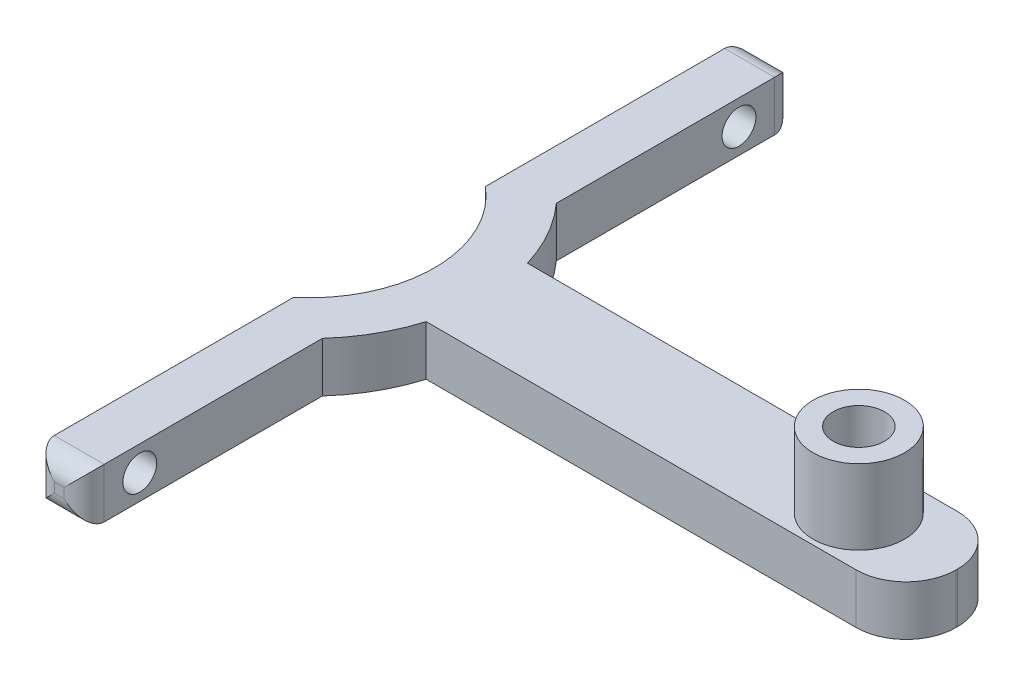
from build123d import *
from build123d.topology import SkipClean

# Parameters (mm, degrees)
SKETCH1_R                = 22.225
SKETCH1_R_2              = 15.875
BOSS_EXTRUDE1_DEPTH      = 3.175
BOSS_EXTRUDE2_DEPTH      = 3.175
F_0_257_DIAMETER_HOLE1_D = 6.5278
SKETCH6_W                = 65.552410467
SKETCH6_H                = 82.171101747
CUT_EXTRUDE2_DEPTH       = 86.310457973
BOSS_EXTRUDE3_DEPTH      = 3.175
SKETCH12_R               = 2.15265
CUT_EXTRUDE4_DEPTH       = 80.867912855
SKETCH13_R               = 5.8039
SKETCH13_R_2             = 3.2639
BOSS_EXTRUDE4_DEPTH      = 9.525
MIRROR2_START            = -3.175
MIRROR2_OUTLINE_R        = 3.2639
MIRROR2_DEPTH            = 1.0223499
MIRROR2_START_2          = 12.081931798
MIRROR2_2_OUTLINE_W      = 2.1526501
MIRROR2_2_OUTLINE_H      = 12.8778
MIRROR2_2_DEPTH          = 70.221427729
MIRROR2_START_3          = 10.16
MIRROR2_3_DEPTH          = 11.111840348
MIRROR2_4_DEPTH          = 6.35
MIRROR2_START_4          = -2.1526501
MIRROR2_5_OUTLINE_R      = 3.2639
MIRROR2_5_DEPTH          = 2.1526501
FILLET5_R                = 2.54


with BuildPart() as part:
    # Sketch1 → Boss-Extrude1 (new body)
    with BuildSketch(Plane(origin=(0, 0, 0), x_dir=(1, 0, 0), z_dir=(0, 1, 0))):
        with Locations(Location((0, 0, 0), (0, 0, 270))):
            Circle(SKETCH1_R)
        with Locations(Location((0, 0, 0), (0, 0, 270))):
            Circle(SKETCH1_R_2, mode=Mode.SUBTRACT)
    extrude(amount=BOSS_EXTRUDE1_DEPTH)

    # Sketch2 → Boss-Extrude2 (add)
    with BuildSketch(Plane(origin=(0, 3.175, 0), x_dir=(1, 0, 0), z_dir=(0, 1, 0))):
        with BuildLine():
            Line((75.953359527, -6.4389), (38.518839527, -6.4389))
            Line((38.518839527, -6.4389), (17.590769706, -6.4389))
            Line((17.590769706, -6.4389), (17.590769706, 6.4389))
            Line((17.590769706, 6.4389), (38.518839527, 6.4389))
            Line((38.518839527, 6.4389), (75.953359527, 6.4389))
            ThreePointArc((75.953359527, 6.4389), (80.443487588, 4.579028061), (82.303359527, 0.0889))
            Line((82.303359527, 0.0889), (82.303359527, -0.0889))
            ThreePointArc((82.303359527, -0.0889), (80.443487588, -4.579028061), (75.953359527, -6.4389))
        make_face()
    extrude(amount=-BOSS_EXTRUDE2_DEPTH)

    # F (0.257) Diameter Hole1 (through all)
    with Locations(Plane(origin=(0, 3.175, 0), x_dir=(1, 0, 0), z_dir=(0, 1, 0))):
        with Locations((69.85, 0)):
            Hole(F_0_257_DIAMETER_HOLE1_D / 2)

    # Sketch6 → Cut-Extrude2 (cut, through all)
    with BuildSketch(Plane(origin=(0, 3.175, 0), x_dir=(1, 0, 0), z_dir=(0, 1, 0))):
        with Locations((-22.616205234, -1.153387837)):
            Rectangle(SKETCH6_W, SKETCH6_H)
    extrude(amount=-CUT_EXTRUDE2_DEPTH, mode=Mode.SUBTRACT)

    # Sketch9 → Boss-Extrude3 (add)
    with BuildSketch(Plane(origin=(0, 3.175, 0), x_dir=(1, 0, 0), z_dir=(0, 1, 0))):
        Polygon((10.16, 19.766765669), (10.16, 45.166765669), (16.51, 45.166765669), (16.51, 14.878525633), align=None)
    boss_extrude3 = extrude(amount=-BOSS_EXTRUDE3_DEPTH)

    # Mirror1: Boss-Extrude3 across plane
    add(boss_extrude3.mirror(Plane.XY))

    # Sketch12 → Cut-Extrude4 (cut, through all)
    with BuildSketch(Plane(origin=(16.51, 0, 0), x_dir=(0, 0, -1), z_dir=(1, 0, 0))):
        with Locations((38.1, 0)):
            Circle(SKETCH12_R)
        with Locations((-38.1, 0)):
            Circle(SKETCH12_R)
    extrude(amount=-CUT_EXTRUDE4_DEPTH, mode=Mode.SUBTRACT)

    # Sketch13 → Boss-Extrude4 (add)
    with SkipClean():  # the faces are left unmerged after this step: merging them gives an invalid solid
        with BuildSketch(Plane(origin=(0, 3.175, 0), x_dir=(1, 0, 0), z_dir=(0, 1, 0))):
            with Locations(Location((69.85, 0, 0), (0, 0, 90))):
                Circle(SKETCH13_R)
            with Locations(Location((69.85, 0, 0), (0, 0, 270))):
                Circle(SKETCH13_R_2, mode=Mode.SUBTRACT)
        extrude(amount=BOSS_EXTRUDE4_DEPTH)



with BuildPart() as body_2:
    # Mirror2: read off the stored shape, not the designer's step
    # Mirror2 outline → Mirror2 (new body)
    with BuildSketch(Plane(origin=(0, 0, 0), x_dir=(1, 0, 0), z_dir=(0, 1, 0)).offset(MIRROR2_START)):
        with BuildLine():
            Line((10.16, 45.166765669), (10.16, 12.197951672))
            ThreePointArc((10.16, 12.197951672), (15.875, 0), (10.16, -12.197951672))
            Line((10.16, -12.197951672), (10.16, -45.166765669))
            Line((10.16, -45.166765669), (16.51, -45.166765669))
            Line((16.51, -45.166765669), (16.51, -14.878525633))
            ThreePointArc((16.51, -14.878525633), (19.356489486, -10.921398252), (21.271840348, -6.4389))
            Line((21.271840348, -6.4389), (75.953359527, -6.4389))
            ThreePointArc((75.953359527, -6.4389), (80.443487588, -4.579028061), (82.303359527, -0.0889))
            Line((82.303359527, -0.0889), (82.303359527, 0.0889))
            ThreePointArc((82.303359527, 0.0889), (80.443487588, 4.579028061), (75.953359527, 6.4389))
            Line((75.953359527, 6.4389), (21.271840348, 6.4389))
            ThreePointArc((21.271840348, 6.4389), (19.356489486, 10.921398252), (16.51, 14.878525633))
            Line((16.51, 14.878525633), (16.51, 45.166765669))
            Line((16.51, 45.166765669), (10.16, 45.166765669))
        make_face()
        with Locations((69.85, 0)):
            Circle(MIRROR2_OUTLINE_R, mode=Mode.SUBTRACT)
    extrude(amount=MIRROR2_DEPTH)


with BuildPart() as part_1:
    with SkipClean():  # the faces are left unmerged after this step: merging them gives an invalid solid
        add(part.part)

        add(body_2.part)  # Mirror2 2 merges body 2
        # Mirror2 2 outline → Mirror2 2 (add)
        with BuildSketch(Plane.YZ.offset(MIRROR2_START_2)):
            with Locations((-1.07632505, 0)):
                Rectangle(MIRROR2_2_OUTLINE_W, MIRROR2_2_OUTLINE_H)
        extrude(amount=MIRROR2_2_DEPTH)

    # Mirror2 3 outline → Mirror2 3 (add)
    with SkipClean():  # the faces are left unmerged after this step: merging them gives an invalid solid
        with BuildSketch(Plane.YZ.offset(MIRROR2_START_3)):
            with BuildLine():
                Line((0, -6.4389), (-2.1526501, -6.4389))
                Line((-2.1526501, -6.4389), (-2.15265, -38.1))
                ThreePointArc((-2.15265, -38.1), (-1.522153413, -36.577846587), (0, -35.94735))
                Line((0, -35.94735), (0, -6.4389))
            make_face()
            with BuildLine():
                Line((-2.15265, 38.1), (-2.1526501, 6.4389))
                Line((-2.1526501, 6.4389), (0, 6.4389))
                Line((0, 6.4389), (0, 35.94735))
                ThreePointArc((0, 35.94735), (-1.522153413, 36.577846587), (-2.15265, 38.1))
            make_face()
        extrude(amount=MIRROR2_3_DEPTH)

    # Mirror2 4 outline → Mirror2 4 (add)
    with SkipClean():  # the faces are left unmerged after this step: merging them gives an invalid solid
        with BuildSketch(Plane.YZ.offset(MIRROR2_START_3)):
            with BuildLine():
                ThreePointArc((0, -40.25265), (-1.522153413, -39.622153413), (-2.15265, -38.1))
                Line((-2.15265, -38.1), (-2.1526501, -45.166765669))
                Line((-2.1526501, -45.166765669), (0, -45.166765669))
                Line((0, -45.166765669), (0, -40.25265))
            make_face()
            with BuildLine():
                Line((-2.1526501, 45.166765669), (-2.15265, 38.1))
                ThreePointArc((-2.15265, 38.1), (-1.522153413, 39.622153413), (0, 40.25265))
                Line((0, 40.25265), (0, 45.166765669))
                Line((0, 45.166765669), (-2.1526501, 45.166765669))
            make_face()
        extrude(amount=MIRROR2_4_DEPTH)

    # Mirror2 5 outline → Mirror2 5 (cut)
    with BuildSketch(Plane(origin=(0, 0, 0), x_dir=(1, 0, 0), z_dir=(0, 1, 0)).offset(MIRROR2_START_4)):
        with BuildLine():
            Line((16.51, 40), (16.51, 14.878525633))
            ThreePointArc((16.51, 14.878525633), (19.356489486, 10.921398252), (21.271840348, 6.4389))
            Line((21.271840348, 6.4389), (21.271840348, 40))
            Line((21.271840348, 40), (16.51, 40))
        make_face()
        with BuildLine():
            Line((82.303359527, 6.4389), (75.953359527, 6.4389))
            ThreePointArc((75.953359527, 6.4389), (80.443487588, 4.579028061), (82.303359527, 0.0889))
            Line((82.303359527, 0.0889), (82.303359527, 6.4389))
        make_face()
        with BuildLine():
            Line((10.16, 6.4389), (12.081931798, 6.4389))
            Line((12.081931798, 6.4389), (12.081931798, -6.4389))
            Line((12.081931798, -6.4389), (10.16, -6.4389))
            Line((10.16, -6.4389), (10.16, -12.197951672))
            ThreePointArc((10.16, -12.197951672), (15.875, 0), (10.16, 12.197951672))
            Line((10.16, 12.197951672), (10.16, 6.4389))
        make_face()
        with BuildLine():
            Line((82.303359527, -6.4389), (82.303359527, -0.0889))
            ThreePointArc((82.303359527, -0.0889), (80.443487588, -4.579028061), (75.953359527, -6.4389))
            Line((75.953359527, -6.4389), (82.303359527, -6.4389))
        make_face()
        with BuildLine():
            Line((21.271840348, -40), (21.271840348, -6.4389))
            ThreePointArc((21.271840348, -6.4389), (19.356489486, -10.921398252), (16.51, -14.878525633))
            Line((16.51, -14.878525633), (16.51, -40))
            Line((16.51, -40), (21.271840348, -40))
        make_face()
        with Locations((69.85, 0)):
            Circle(MIRROR2_5_OUTLINE_R)
    extrude(amount=MIRROR2_5_DEPTH, mode=Mode.SUBTRACT)

    # Fillet5
    fillet5_edges = [part_1.edges().sort_by_distance(p)[0] for p in [
        (13.335, -3.175, -45.166765669),
        (13.335, -3.175, 45.166765669),
        (13.335, 3.175, -45.166765669),
        (10.16, 1.5875, -45.166765669),
        (16.51, 1.5875, -45.166765669),
        (13.335, 3.175, 45.166765669),
        (16.51, 1.5875, 45.166765669),
        (10.16, 1.5875, 45.166765669),
    ]]
    fillet(fillet5_edges, radius=FILLET5_R)


solid = part_1.part
